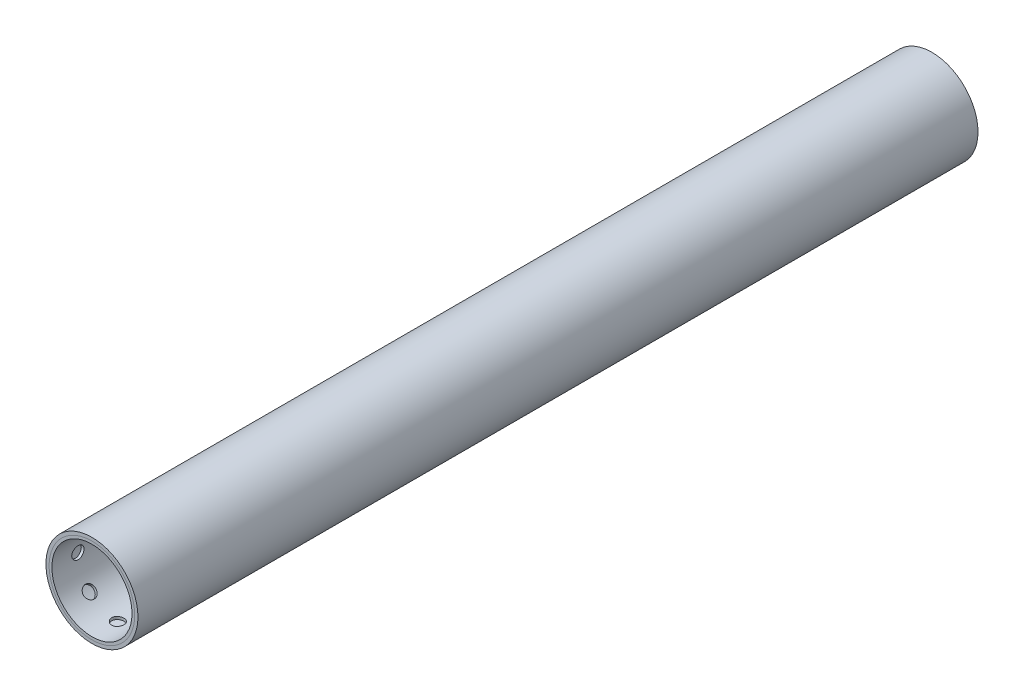
from build123d import *

# Parameters (mm, degrees)
CROQUIS1_R              = 28.0509
CROQUIS1_R_2            = 26.2509
SALIENTE_EXTRUIR1_DEPTH = 550.5
MATRIZC1_COUNT          = 8
CROQUIS2_R              = 30.1625
CROQUIS2_R_2            = 28.0509
SALIENTE_EXTRUIR2_DEPTH = 550.5


with BuildPart() as part:
    # Croquis1 → Saliente-Extruir1 (new body)
    with BuildSketch(Plane.XY):
        Circle(CROQUIS1_R)
        Circle(CROQUIS1_R_2, mode=Mode.SUBTRACT)
    extrude(amount=-SALIENTE_EXTRUIR1_DEPTH)

    # Croquis13 → Ø8.0mm Dowel Hole1 (revolve, cut)
    with BuildSketch(Plane(origin=(0, 28.0509, -535), x_dir=(0, 0, 1), z_dir=(1, 0, 0))):
        Polygon((0, 0), (0, 9.403442476), (4, 7), (4, 0), align=None)
    f_8_0mm_dowel_hole1 = revolve(axis=Axis((0, 34.4009, -535), (0, -1, 0)), mode=Mode.SUBTRACT)

    # Croquis17 → Ø8.0mm Dowel Hole2 (revolve, cut)
    with BuildSketch(Plane(origin=(0, 28.0509, -17), x_dir=(0, 0, 1), z_dir=(1, 0, 0))):
        Polygon((0, 0), (0, 9.403442476), (4, 7), (4, 0), align=None)
    f_8_0mm_dowel_hole2 = revolve(axis=Axis((0, 34.4009, -17), (0, -1, 0)), mode=Mode.SUBTRACT)

    # MatrizC1: Ø8.0mm Dowel Hole1, Ø8.0mm Dowel Hole2 ×8 about axis
    matrizc1_axis = Axis((0, 0, -550.5), (0, 0, 1))
    add([f_8_0mm_dowel_hole1.rotate(matrizc1_axis, i * 360 / MATRIZC1_COUNT) for i in range(1, MATRIZC1_COUNT)], mode=Mode.SUBTRACT)
    add([f_8_0mm_dowel_hole2.rotate(matrizc1_axis, i * 360 / MATRIZC1_COUNT) for i in range(1, MATRIZC1_COUNT)], mode=Mode.SUBTRACT)


with BuildPart() as body_2:
    # Croquis2 → Saliente-Extruir2 (new body)
    with BuildSketch(Plane.XY):
        Circle(CROQUIS2_R)
        Circle(CROQUIS2_R_2, mode=Mode.SUBTRACT)
    extrude(amount=-SALIENTE_EXTRUIR2_DEPTH)


solid = Compound([part.part, body_2.part])
